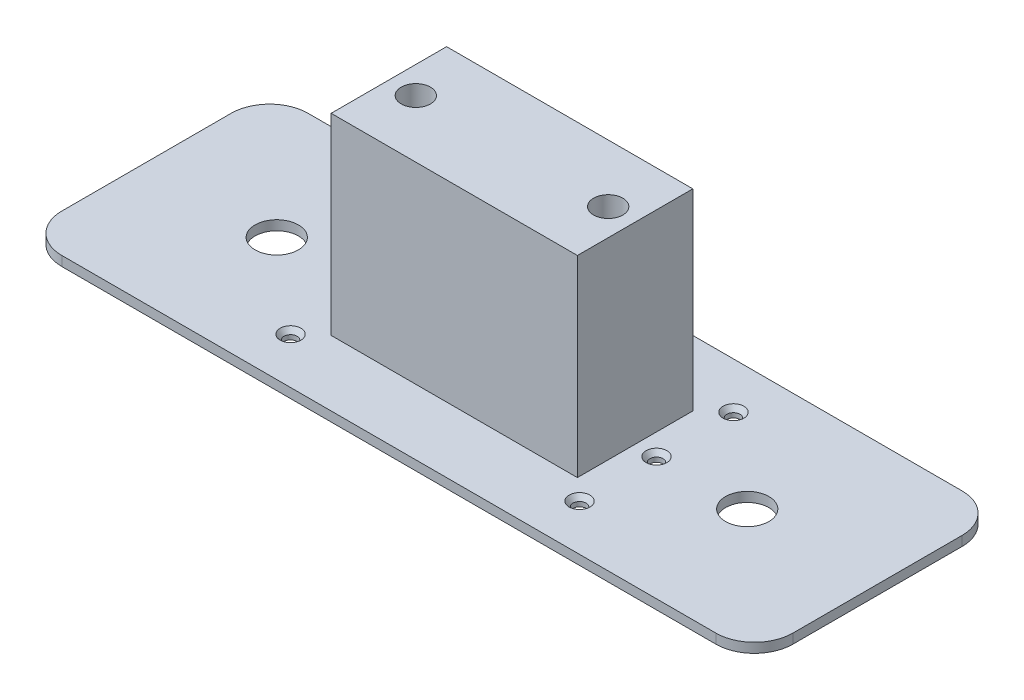
from build123d import *

# Parameters (mm, degrees)
SKETCH1_W                      = 120.65
SKETCH1_H                      = 40.64
BOSS_EXTRUDE1_DEPTH            = 1.5875
FILLET1_R                      = 6.35
SKETCH2_W                      = 40.64
SKETCH2_H                      = 19.05
BOSS_EXTRUDE2_DEPTH            = 31.75
F_10_CLEARANCE_HOLE1_D         = 4.826
F_10_CLEARANCE_HOLE1_DEPTH     = 25.4
F_10_CLEARANCE_HOLE1_TIP       = 1.449876674
F_2_CLEARANCE_HOLE1_AT_2_COUNT = 2
F_2_CLEARANCE_HOLE1_AT_2_PITCH = 12.7
F_2_CLEARANCE_HOLE1_AT_3_COUNT = 2
F_2_CLEARANCE_HOLE1_AT_3_PITCH = 25.4
F_2_CLEARANCE_HOLE1_AT_4_COUNT = 2
F_2_CLEARANCE_HOLE1_AT_4_PITCH = 54.041188126
F_2_CLEARANCE_HOLE1_AT_5_COUNT = 2
F_2_CLEARANCE_HOLE1_AT_5_PITCH = 49.361726207
F_2_CLEARANCE_HOLE1_AT_6_COUNT = 2
F_2_CLEARANCE_HOLE1_AT_6_PITCH = 47.700000148
SKETCH13_R                     = 3.5749992
CUT_EXTRUDE1_DEPTH             = 72.856780691


with BuildPart() as part:
    # Sketch1 → Boss-Extrude1 (new body)
    with BuildSketch(Plane(origin=(0, 0, 0), x_dir=(1, 0, 0), z_dir=(0, 1, 0))):
        Rectangle(SKETCH1_W, SKETCH1_H)
    extrude(amount=BOSS_EXTRUDE1_DEPTH)

    # Fillet1
    fillet1_edges = [part.edges().sort_by_distance(p)[0] for p in [
        (-60.325, 0.79375, 20.32),
        (-60.325, 0.79375, -20.32),
        (60.325, 0.79375, -20.32),
        (60.325, 0.79375, 20.32),
    ]]
    fillet(fillet1_edges, radius=FILLET1_R)

    # Sketch2 → Boss-Extrude2 (add)
    with BuildSketch(Plane(origin=(0, 1.5875, 0), x_dir=(1, 0, 0), z_dir=(0, 1, 0))):
        Rectangle(SKETCH2_W, SKETCH2_H)
    extrude(amount=BOSS_EXTRUDE2_DEPTH)

    # #10 Clearance Hole1
    with Locations(Plane(origin=(0, 33.3375, 0), x_dir=(1, 0, 0), z_dir=(0, 1, 0))):
        with Locations((-15.875, 0), (15.875, 0)):
            Hole(F_10_CLEARANCE_HOLE1_D / 2, depth=F_10_CLEARANCE_HOLE1_DEPTH)
            with Locations((0, 0, -(F_10_CLEARANCE_HOLE1_DEPTH + F_10_CLEARANCE_HOLE1_TIP / 2))):  # 118° drill point
                Cone(0, F_10_CLEARANCE_HOLE1_D / 2, F_10_CLEARANCE_HOLE1_TIP, mode=Mode.SUBTRACT)

    # Sketch12 → #2 Clearance Hole1 (revolve, cut)
    with BuildSketch(Plane(origin=(-23.850000074, 1.5875, -12.7), x_dir=(0, 0, 1), z_dir=(1, 0, 0))):
        Polygon((0, 0), (0, 1.5875), (1.0795, 1.5875), (1.0795, 0.827548112), (1.7145, 0), align=None)
    f_2_clearance_hole1 = revolve(axis=Axis((-23.850000074, 7.9375, -12.7), (0, -1, 0)), mode=Mode.SUBTRACT)

    # #2 Clearance Hole1 at 2: #2 Clearance Hole1 ×2
    with Locations(*[(0, 0, i * F_2_CLEARANCE_HOLE1_AT_2_PITCH) for i in range(1, F_2_CLEARANCE_HOLE1_AT_2_COUNT)]):
        add(f_2_clearance_hole1, mode=Mode.SUBTRACT)

    # #2 Clearance Hole1 at 3: #2 Clearance Hole1 ×2
    with Locations(*[(0, 0, i * F_2_CLEARANCE_HOLE1_AT_3_PITCH) for i in range(1, F_2_CLEARANCE_HOLE1_AT_3_COUNT)]):
        add(f_2_clearance_hole1, mode=Mode.SUBTRACT)

    # #2 Clearance Hole1 at 4: #2 Clearance Hole1 ×2
    with Locations(*[Vector(0.8826600931937462, 0, 0.4700118720662355) * (i * F_2_CLEARANCE_HOLE1_AT_4_PITCH) for i in range(1, F_2_CLEARANCE_HOLE1_AT_4_COUNT)]):
        add(f_2_clearance_hole1, mode=Mode.SUBTRACT)

    # #2 Clearance Hole1 at 5: #2 Clearance Hole1 ×2
    with Locations(*[Vector(0.9663357385056085, 0, 0.2572843572524773) * (i * F_2_CLEARANCE_HOLE1_AT_5_PITCH) for i in range(1, F_2_CLEARANCE_HOLE1_AT_5_COUNT)]):
        add(f_2_clearance_hole1, mode=Mode.SUBTRACT)

    # #2 Clearance Hole1 at 6: #2 Clearance Hole1 ×2
    with Locations(*[(i * F_2_CLEARANCE_HOLE1_AT_6_PITCH, 0, 0) for i in range(1, F_2_CLEARANCE_HOLE1_AT_6_COUNT)]):
        add(f_2_clearance_hole1, mode=Mode.SUBTRACT)

    # Sketch13 → Cut-Extrude1 (cut, through all)
    with BuildSketch(Plane(origin=(0, 0, 0), x_dir=(-1, 0, 0), z_dir=(0, -1, 0))):
        with Locations((38.825000074, 0)):
            Circle(SKETCH13_R)
        with Locations((-38.825000074, 0)):
            Circle(SKETCH13_R)
    extrude(amount=-CUT_EXTRUDE1_DEPTH, mode=Mode.SUBTRACT)


solid = part.part
